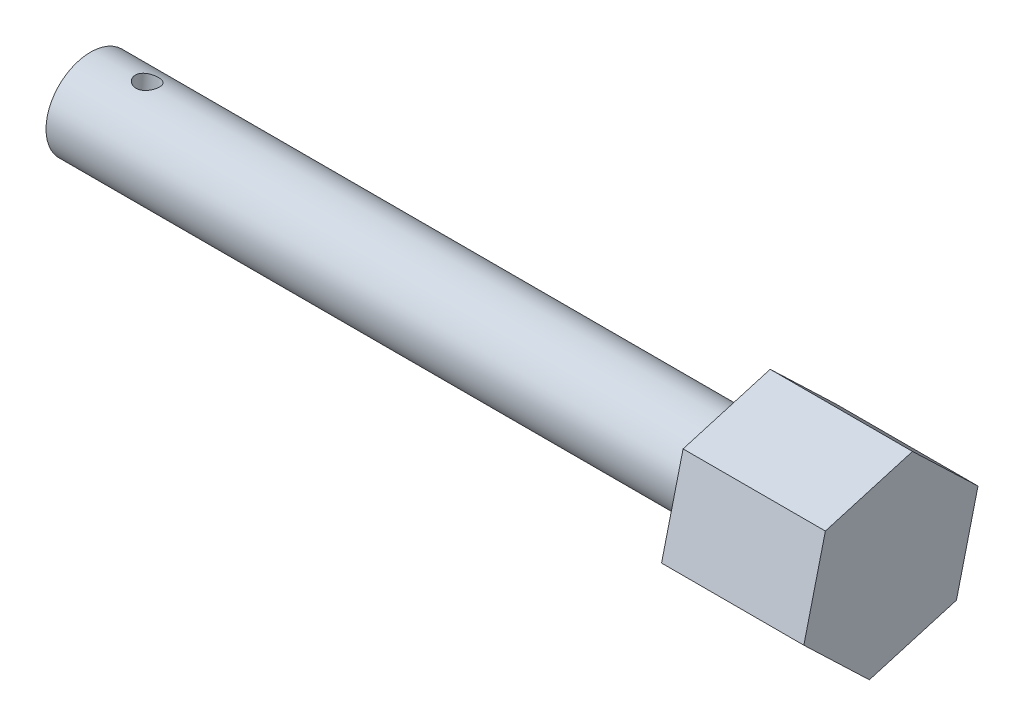
from build123d import *

# Parameters (mm, degrees)
SKETCH1_R           = 3.175
BOSS_EXTRUDE2_DEPTH = 46.99
BOSS_EXTRUDE3_DEPTH = 10.16
SKETCH3_R           = 3.175
SKETCH3_R_2         = 1.778
CUT_EXTRUDE1_DEPTH  = 19.05
SKETCH6_R           = 3.175
BOSS_EXTRUDE5_DEPTH = 49.022
CUT_EXTRUDE5_DEPTH  = 38.1
SKETCH8_R           = 0.8001
CUT_EXTRUDE6_DEPTH  = 2.54


with BuildPart() as part:
    # Sketch1 → Boss-Extrude2 (new body)
    with BuildSketch(Plane(origin=(0, 0, 0), x_dir=(0, 0, -1), z_dir=(1, 0, 0))):
        Circle(SKETCH1_R)
    extrude(amount=BOSS_EXTRUDE2_DEPTH)

    # Sketch2 → Boss-Extrude3 (add)
    with BuildSketch(Plane(origin=(46.99, 0, 0), x_dir=(0, 0, -1), z_dir=(1, 0, 0))):
        Polygon((-4.67882504, 4.478159594), (-6.217612491, -1.812901548), (-1.538787451, -6.291061142), (4.67882504, -4.478159594), (6.217612491, 1.812901548), (1.538787451, 6.291061142), align=None)
    extrude(amount=BOSS_EXTRUDE3_DEPTH)

    # Sketch3 → Cut-Extrude1 (cut)
    with BuildSketch(Plane.ZY):
        Circle(SKETCH3_R)
        Circle(SKETCH3_R_2, mode=Mode.SUBTRACT)
    extrude(amount=-CUT_EXTRUDE1_DEPTH, mode=Mode.SUBTRACT)

    # Sketch6 → Boss-Extrude5 (add)
    with BuildSketch(Plane.ZY):
        Circle(SKETCH6_R)
    extrude(amount=-BOSS_EXTRUDE5_DEPTH)

    # Sketch7 → Cut-Extrude5 (cut)
    with BuildSketch(Plane.ZY):
        Polygon((-0.489261374, 0.714579112), (-0.863474351, -0.066423223), (-0.374212977, -0.781002335), (0.489261374, -0.714579112), (0.863474351, 0.066423223), (0.374212977, 0.781002335), align=None)
    extrude(amount=-CUT_EXTRUDE5_DEPTH, mode=Mode.SUBTRACT)

    # Sketch8 → Cut-Extrude6 (cut)
    with BuildSketch(Plane(origin=(0, 0.747790724, -0.057524199), x_dir=(1, 0, 0), z_dir=(0, -0.9970542983864019, 0.07669893134327219))):
        with Locations((3.81, 0)):
            Circle(SKETCH8_R)
    extrude(amount=-CUT_EXTRUDE6_DEPTH, mode=Mode.SUBTRACT)


solid = part.part
